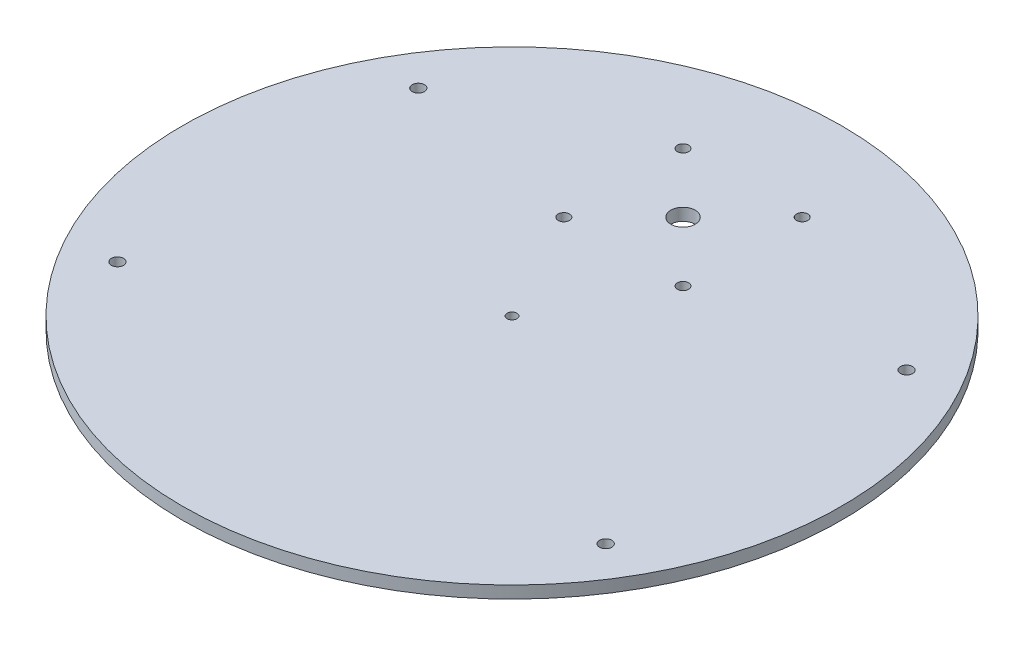
from build123d import *

# Parameters (mm, degrees)
SKETCH1_R           = 85.725
BOSS_EXTRUDE1_DEPTH = 3.175
CUT_EXTRUDE1_REACH  = 123.275
SKETCH2_R           = 1.5875
CUT_EXTRUDE2_REACH  = 123.275
SKETCH3_R           = 3.175
CUT_EXTRUDE3_REACH  = 123.275
SKETCH5_R           = 1.4732
CENTER_HOLE_REACH   = 123.275
SKETCH6_R           = 1.27


with BuildPart() as part:
    # Sketch1 → Boss-Extrude1 (new body)
    with BuildSketch(Plane(origin=(0, 0, 0), x_dir=(1, 0, 0), z_dir=(0, 1, 0))):
        Circle(SKETCH1_R)
    extrude(amount=BOSS_EXTRUDE1_DEPTH)

    # Sketch2 → Cut-Extrude1 (cut, up to next)
    with BuildSketch(Plane(origin=(0, 3.175, 0), x_dir=(1, 0, 0), z_dir=(0, 1, 0)), mode=Mode.PRIVATE) as cut_extrude1_sk1:
        with Locations((-63.5, 39.13251)):
            Circle(SKETCH2_R)
    cut_extrude1_tool1 = extrude(cut_extrude1_sk1.sketch, amount=-CUT_EXTRUDE1_REACH, mode=Mode.PRIVATE) & part.part
    # Sketch2 → Cut-Extrude1 (cut, up to next)
    with BuildSketch(Plane(origin=(0, 3.175, 0), x_dir=(1, 0, 0), z_dir=(0, 1, 0)), mode=Mode.PRIVATE) as cut_extrude1_sk2:
        with Locations((63.5, 39.13251)):
            Circle(SKETCH2_R)
    cut_extrude1_tool2 = extrude(cut_extrude1_sk2.sketch, amount=-CUT_EXTRUDE1_REACH, mode=Mode.PRIVATE) & part.part
    # Sketch2 → Cut-Extrude1 (cut, up to next)
    with BuildSketch(Plane(origin=(0, 3.175, 0), x_dir=(1, 0, 0), z_dir=(0, 1, 0)), mode=Mode.PRIVATE) as cut_extrude1_sk3:
        with Locations((-63.5, -39.13251)):
            Circle(SKETCH2_R)
    cut_extrude1_tool3 = extrude(cut_extrude1_sk3.sketch, amount=-CUT_EXTRUDE1_REACH, mode=Mode.PRIVATE) & part.part
    # Sketch2 → Cut-Extrude1 (cut, up to next)
    with BuildSketch(Plane(origin=(0, 3.175, 0), x_dir=(1, 0, 0), z_dir=(0, 1, 0)), mode=Mode.PRIVATE) as cut_extrude1_sk4:
        with Locations((63.5, -39.13251)):
            Circle(SKETCH2_R)
    cut_extrude1_tool4 = extrude(cut_extrude1_sk4.sketch, amount=-CUT_EXTRUDE1_REACH, mode=Mode.PRIVATE) & part.part
    add(cut_extrude1_tool1.solids().sort_by_distance((-63.5, 3.175, -39.13251))[0], mode=Mode.SUBTRACT)
    add(cut_extrude1_tool2.solids().sort_by_distance((63.5, 3.175, -39.13251))[0], mode=Mode.SUBTRACT)
    add(cut_extrude1_tool3.solids().sort_by_distance((-63.5, 3.175, 39.13251))[0], mode=Mode.SUBTRACT)
    add(cut_extrude1_tool4.solids().sort_by_distance((63.5, 3.175, 39.13251))[0], mode=Mode.SUBTRACT)

    # Sketch3 → Cut-Extrude2 (cut, up to next)
    with BuildSketch(Plane(origin=(0, 3.175, 0), x_dir=(1, 0, 0), z_dir=(0, 1, 0)), mode=Mode.PRIVATE) as cut_extrude2_sk1:
        with Locations((0, 44.482150941)):
            Circle(SKETCH3_R)
    cut_extrude2_tool1 = extrude(cut_extrude2_sk1.sketch, amount=-CUT_EXTRUDE2_REACH, mode=Mode.PRIVATE) & part.part
    add(cut_extrude2_tool1.solids().sort_by_distance((0, 3.175, -44.482151))[0], mode=Mode.SUBTRACT)

    # Sketch5 → Cut-Extrude3 (cut, up to next)
    with BuildSketch(Plane(origin=(0, 3.175, 0), x_dir=(1, 0, 0), z_dir=(0, 1, 0)), mode=Mode.PRIVATE) as cut_extrude3_sk1:
        with Locations((-15.50035, 59.982500941)):
            Circle(SKETCH5_R)
    cut_extrude3_tool1 = extrude(cut_extrude3_sk1.sketch, amount=-CUT_EXTRUDE3_REACH, mode=Mode.PRIVATE) & part.part
    # Sketch5 → Cut-Extrude3 (cut, up to next)
    with BuildSketch(Plane(origin=(0, 3.175, 0), x_dir=(1, 0, 0), z_dir=(0, 1, 0)), mode=Mode.PRIVATE) as cut_extrude3_sk2:
        with Locations((15.50035, 59.982500941)):
            Circle(SKETCH5_R)
    cut_extrude3_tool2 = extrude(cut_extrude3_sk2.sketch, amount=-CUT_EXTRUDE3_REACH, mode=Mode.PRIVATE) & part.part
    # Sketch5 → Cut-Extrude3 (cut, up to next)
    with BuildSketch(Plane(origin=(0, 3.175, 0), x_dir=(1, 0, 0), z_dir=(0, 1, 0)), mode=Mode.PRIVATE) as cut_extrude3_sk3:
        with Locations((-15.50035, 28.981800941)):
            Circle(SKETCH5_R)
    cut_extrude3_tool3 = extrude(cut_extrude3_sk3.sketch, amount=-CUT_EXTRUDE3_REACH, mode=Mode.PRIVATE) & part.part
    # Sketch5 → Cut-Extrude3 (cut, up to next)
    with BuildSketch(Plane(origin=(0, 3.175, 0), x_dir=(1, 0, 0), z_dir=(0, 1, 0)), mode=Mode.PRIVATE) as cut_extrude3_sk4:
        with Locations((15.50035, 28.981800941)):
            Circle(SKETCH5_R)
    cut_extrude3_tool4 = extrude(cut_extrude3_sk4.sketch, amount=-CUT_EXTRUDE3_REACH, mode=Mode.PRIVATE) & part.part
    add(cut_extrude3_tool1.solids().sort_by_distance((-15.50035, 3.175, -59.982501))[0], mode=Mode.SUBTRACT)
    add(cut_extrude3_tool2.solids().sort_by_distance((15.50035, 3.175, -59.982501))[0], mode=Mode.SUBTRACT)
    add(cut_extrude3_tool3.solids().sort_by_distance((-15.50035, 3.175, -28.981801))[0], mode=Mode.SUBTRACT)
    add(cut_extrude3_tool4.solids().sort_by_distance((15.50035, 3.175, -28.981801))[0], mode=Mode.SUBTRACT)

    # Sketch6 → center_hole (cut, up to next)
    with BuildSketch(Plane(origin=(0, 3.175, 0), x_dir=(1, 0, 0), z_dir=(0, 1, 0)), mode=Mode.PRIVATE) as center_hole_sk1:
        Circle(SKETCH6_R)
    center_hole_tool1 = extrude(center_hole_sk1.sketch, amount=-CENTER_HOLE_REACH, mode=Mode.PRIVATE) & part.part
    add(center_hole_tool1.solids().sort_by_distance((0, 3.175, 0))[0], mode=Mode.SUBTRACT)


solid = part.part
